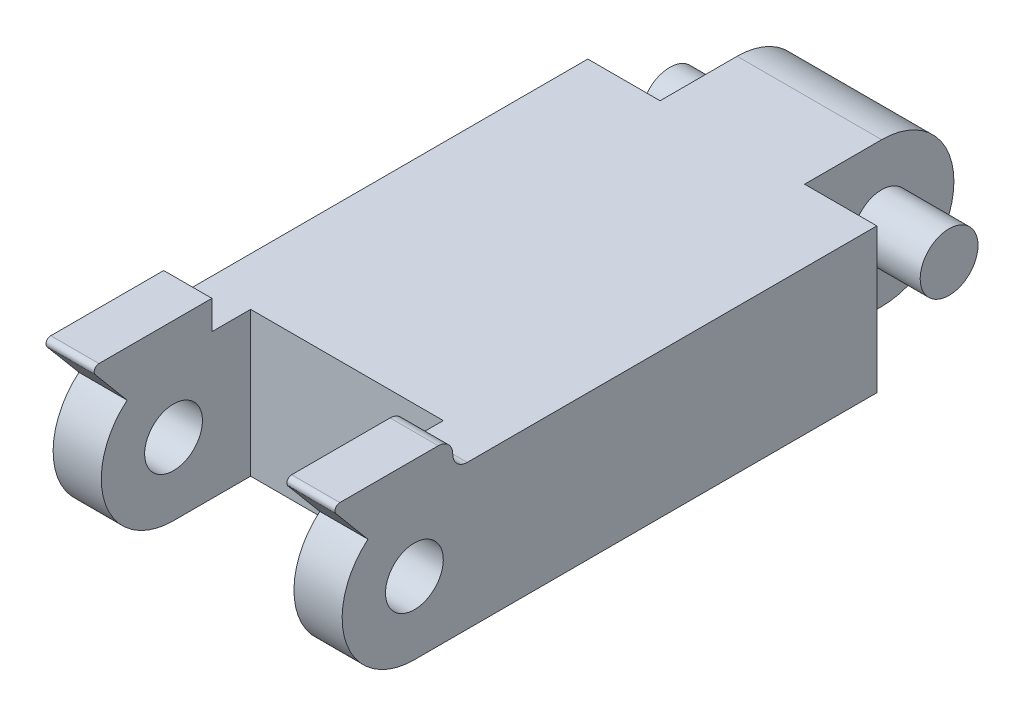
from build123d import *

# Parameters (mm, degrees)
SKETCH_1_W             = 30
SKETCH_1_H             = 15
EXTRUDE_1_DEPTH        = 40
EXTRUDE_2_DEPTH        = 5
SKETCH_3_R             = 3
CUT_EXTRUDE_1_DEPTH    = 5
EXTRUDE_3_DEPTH        = 7.5
SKETCH_7_R             = 3
EXTRUDE_4_DEPTH        = 7
EXTRUDE_5_DEPTH        = 5
FILLET_2_R             = 1.5
FILLET_3_R             = 0.5
FILLET_3_OF_MIRROR_3_R = 0.5


with BuildPart() as part:
    # 草图1 → 凸台-拉伸1 (new body)
    with BuildSketch(Plane.XY):
        Rectangle(SKETCH_1_W, SKETCH_1_H)
    extrude(amount=EXTRUDE_1_DEPTH)

    # 草图2 → 凸台-拉伸2 (add)
    with BuildSketch(Plane(origin=(15, 0, 0), x_dir=(0, 0, -1), z_dir=(1, 0, 0))):
        with BuildLine():
            Line((-40, -7.5), (-48, -7.5))
            ThreePointArc((-48, -7.5), (-55.5, 0), (-48, 7.5))
            Line((-48, 7.5), (-40, 7.5))
            Line((-40, 7.5), (-40, -7.5))
        make_face()
    extrude_2 = extrude(amount=-EXTRUDE_2_DEPTH)

    # 草图3 → 切除-拉伸1 (cut)
    with BuildSketch(Plane(origin=(15, 0, 0), x_dir=(0, 0, -1), z_dir=(1, 0, 0))):
        with Locations(Location((-48, 0, 0), (0, 0, 90))):
            Circle(SKETCH_3_R)
    cut_extrude_1 = extrude(amount=-CUT_EXTRUDE_1_DEPTH, mode=Mode.SUBTRACT)

    # 镜向1: 凸台-拉伸2, 切除-拉伸1 across plane
    add(extrude_2.mirror(Plane(origin=(0, 0, 0), x_dir=(0, 0, 1), z_dir=(1, 0, 0))))
    add(cut_extrude_1.mirror(Plane(origin=(0, 0, 0), x_dir=(0, 0, 1), z_dir=(1, 0, 0))), mode=Mode.SUBTRACT)

    # 草图6 → 凸台-拉伸3 (add, symmetric)
    with BuildSketch(Plane(origin=(0, 0, 0), x_dir=(0, 0, -1), z_dir=(1, 0, 0))):
        with BuildLine():
            Line((0, 7.5), (8, 7.5))
            ThreePointArc((8, 7.5), (15.5, 0), (8, -7.5))
            Line((8, -7.5), (0, -7.5))
            Line((0, -7.5), (0, 7.5))
        make_face()
    extrude(amount=EXTRUDE_3_DEPTH, both=True)

    # 草图7 → 凸台-拉伸4 (add)
    with BuildSketch(Plane(origin=(7.5, 0, 0), x_dir=(0, 0, -1), z_dir=(1, 0, 0))):
        with Locations(Location((8, 0, 0), (0, 0, 180))):
            Circle(SKETCH_7_R)
    extrude_4 = extrude(amount=EXTRUDE_4_DEPTH)

    # 镜向2: 凸台-拉伸4 across plane
    add(extrude_4.mirror(Plane(origin=(0, 0, 0), x_dir=(0, 0, 1), z_dir=(1, 0, 0))))

    # 草图8 → 凸台-拉伸5 (add)
    with BuildSketch(Plane(origin=(15, 0, 0), x_dir=(0, 0, -1), z_dir=(1, 0, 0))):
        with BuildLine():
            Line((-56.810546127, 10.5), (-52.820907073, 5.745333323))
            ThreePointArc((-52.820907073, 5.745333323), (-50.565151075, 7.047694656), (-48, 7.5))
            Line((-48, 7.5), (-44.01973259, 7.5))
            Line((-44.01973259, 7.5), (-44.01973259, 10.5))
            Line((-44.01973259, 10.5), (-56.810546127, 10.5))
        make_face()
    extrude_5 = extrude(amount=-EXTRUDE_5_DEPTH)

    # 圆角2
    fillet_2_edges = [part.edges().sort_by_distance(p)[0] for p in [
        (12.5, 7.5, 44.01973259),
    ]]
    fillet(fillet_2_edges, radius=FILLET_2_R)
    fillet_2_2_edges = [part.edges().sort_by_distance(p)[0] for p in [
        (12.5, 10.5, 44.01973259),
    ]]
    fillet(fillet_2_2_edges, radius=FILLET_2_R - 0.0001)  # a hair under: the kernel refuses the full size

    # 圆角3
    fillet_3_edges = [part.edges().sort_by_distance(p)[0] for p in [
        (12.5, 10.5, 56.810546127),
    ]]
    fillet(fillet_3_edges, radius=FILLET_3_R)

    # 镜向3: 凸台-拉伸5 across plane
    add(extrude_5.mirror(Plane(origin=(0, 0, 0), x_dir=(0, 0, 1), z_dir=(1, 0, 0))))

    # 圆角3 of 镜向3
    fillet_3_of_mirror_3_edges = [part.edges().sort_by_distance(p)[0] for p in [
        (-12.5, 10.5, 56.810546127),
    ]]
    fillet(fillet_3_of_mirror_3_edges, radius=FILLET_3_OF_MIRROR_3_R)


solid = part.part
